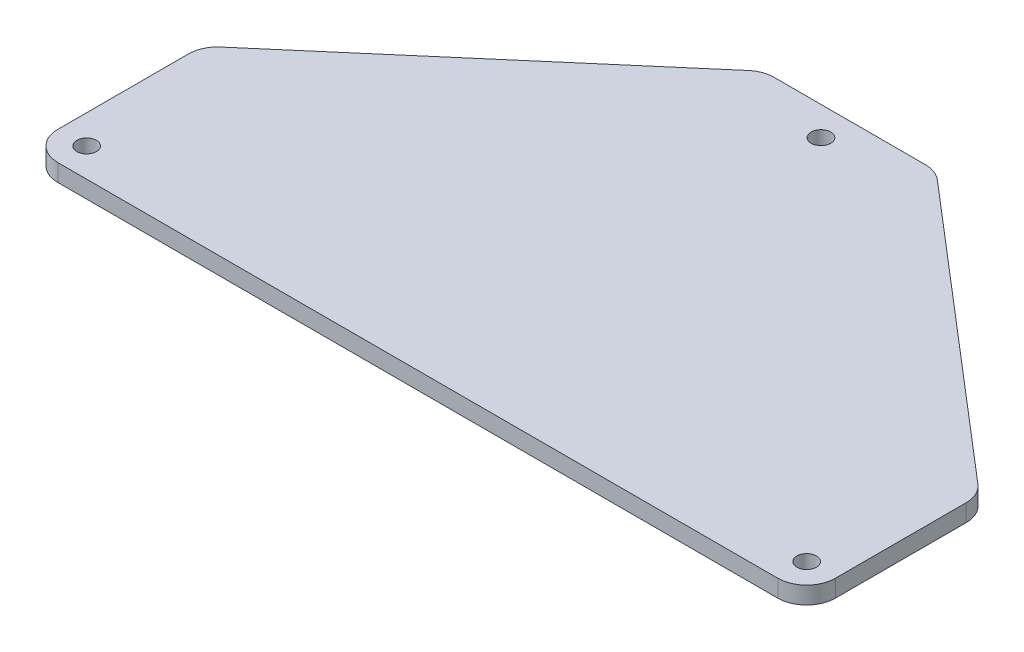
from build123d import *

# Parameters (mm, degrees)
BOSS_EXTRU_1_DEPTH   = 3
CONG_1_R             = 5
D_GAGEMENT_M31_D     = 3.4
D_GAGEMENT_M31_DEPTH = 10
D_GAGEMENT_M31_TIP   = 1.021463052


with BuildPart() as part:
    # Esquisse1 → Boss.-Extru.1 (new body)
    with BuildSketch(Plane(origin=(0, 0, 0), x_dir=(1, 0, 0), z_dir=(0, 1, 0))):
        Polygon((-67.5, 0), (67.5, 0), (67.5, 30), (15, 75), (-15, 75), (-67.5, 30), align=None)
    extrude(amount=BOSS_EXTRU_1_DEPTH)

    # Congé1
    cong_1_edges = [part.edges().sort_by_distance(p)[0] for p in [
        (-67.5, 1.5, 0),
        (-67.5, 1.5, -30),
        (-15, 1.5, -75),
        (15, 1.5, -75),
        (67.5, 1.5, -30),
        (67.5, 1.5, 0),
    ]]
    fillet(cong_1_edges, radius=CONG_1_R)

    # Dégagement M31
    with Locations(Plane(origin=(0, 3, 0), x_dir=(1, 0, 0), z_dir=(0, 1, 0))):
        with Locations((-62.5, 5), (62.5, 5), (0, 70)):
            Hole(D_GAGEMENT_M31_D / 2, depth=D_GAGEMENT_M31_DEPTH)
            with Locations((0, 0, -(D_GAGEMENT_M31_DEPTH + D_GAGEMENT_M31_TIP / 2))):  # 118° drill point
                Cone(0, D_GAGEMENT_M31_D / 2, D_GAGEMENT_M31_TIP, mode=Mode.SUBTRACT)


solid = part.part
